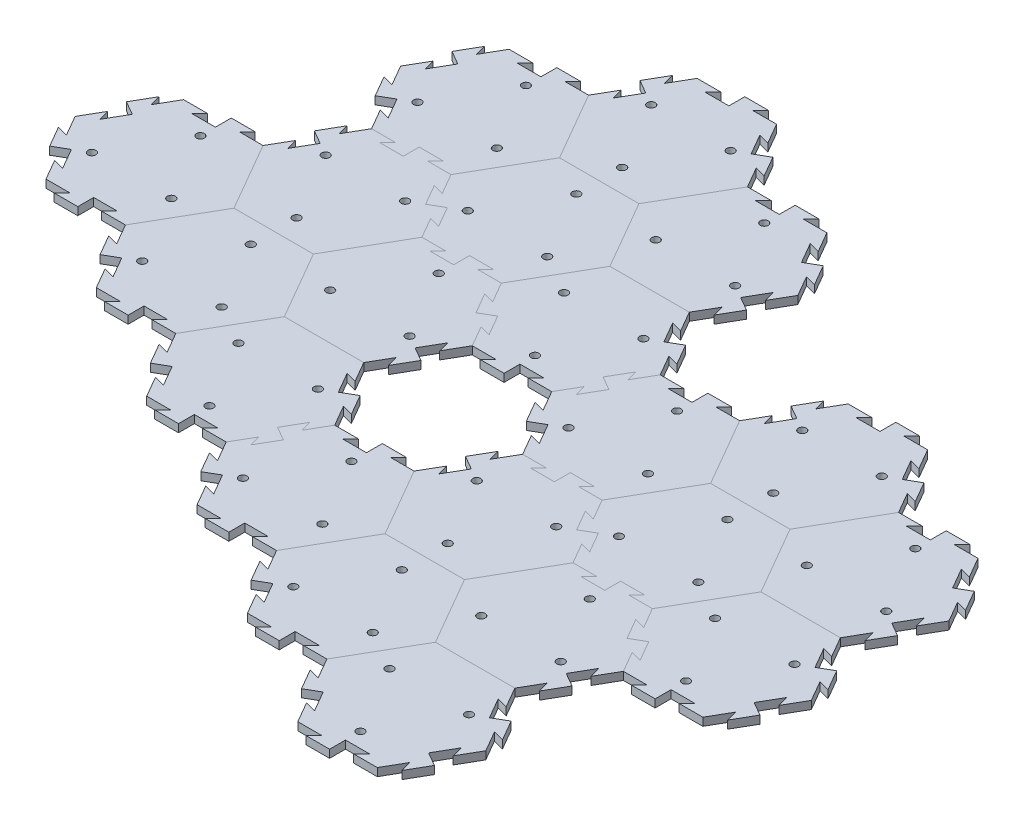
from build123d import *

# Parameters (mm, degrees)
BOSS_EXTRUDE1_DEPTH     = 6.35
SKETCH9_R               = 3.175
CUT_EXTRUDE3_DEPTH      = 85.242269675
CIRPATTERN6_COUNT       = 3
CUT_EXTRUDE2_DEPTH      = 194.232075495
BOSS_EXTRUDE3_DEPTH     = 6.35
CIRPATTERN3_COUNT       = 3
CIRPATTERN3_ANGLE       = 120
CIRPATTERN5_START       = -6.35
CIRPATTERN5_OUTLINE_R   = 3.175
CIRPATTERN5_DEPTH       = 6.35
CIRPATTERN5_2_OUTLINE_R = 3.175
CIRPATTERN5_2_DEPTH     = 6.35
CIRPATTERN5_3_OUTLINE_R = 3.175
CIRPATTERN5_3_DEPTH     = 6.35
BOSS_EXTRUDE4_DEPTH     = 6.35
CUT_EXTRUDE4_DEPTH      = 234.655972662
CIRPATTERN7_COUNT       = 2
CIRPATTERN7_ANGLE       = 60
CUT_EXTRUDE5_DEPTH      = 234.655972662
BOSS_EXTRUDE5_DEPTH     = 6.35
CUT_EXTRUDE6_DEPTH      = 234.655972662
BOSS_EXTRUDE6_DEPTH     = 6.35
LPATTERN3_COUNT         = 2
LPATTERN3_PITCH         = 329.955678924
LPATTERN3_2_COUNT       = 2
LPATTERN3_2_PITCH       = 190.5


# Read off the part's stored shape, not the designer's step: CirPattern5
with BuildPart() as part:
    # Sketch1 → Boss-Extrude1 (new body)
    with BuildSketch(Plane(origin=(0, 0, 0), x_dir=(1, 0, 0), z_dir=(0, 1, 0))):
        Polygon((63.5, 0), (31.75, 54.99261314), (-31.75, 54.99261314), (-63.5, 0), (-31.75, -54.99261314), (31.75, -54.99261314), align=None)
    extrude(amount=-BOSS_EXTRUDE1_DEPTH)

    # Sketch9 → Cut-Extrude3 (cut, through all)
    with BuildSketch(Plane(origin=(0, 0, 0), x_dir=(1, 0, 0), z_dir=(0, 1, 0))):
        with Locations(Location((-31.75, -18.330871047, 0), (0, 0, 270))):
            Circle(SKETCH9_R)
    cut_extrude3 = extrude(amount=-CUT_EXTRUDE3_DEPTH, mode=Mode.SUBTRACT)

    # CirPattern6: Cut-Extrude3 ×3 about axis
    cirpattern6_axis = Axis((0, 0, 0), (0, 1, 0))
    for i in range(1, CIRPATTERN6_COUNT):
        add(cut_extrude3.rotate(cirpattern6_axis, i * 360 / CIRPATTERN6_COUNT), mode=Mode.SUBTRACT)


with BuildPart() as body_2:
    # Mirror1: mirrored copy
    add(part.part.mirror(Plane(origin=(31.75, -6.35, 54.99261314), x_dir=(-0.4999999999999997, 0, 0.8660254037844387), z_dir=(0.8660254037844387, 0, 0.49999999999999983))))

    # Sketch5 → Cut-Extrude2 (cut, through all)
    with BuildSketch(Plane(origin=(0, 0, 0), x_dir=(1, 0, 0), z_dir=(0, 1, 0))):
        Polygon((136.525, -16.497783942), (127.850738686, -14.173522628), (137.375738686, -30.67130657), (142.875, -27.49630657), align=None)
    cut_extrude2 = extrude(amount=-CUT_EXTRUDE2_DEPTH, mode=Mode.SUBTRACT)

    # Sketch7 → Boss-Extrude3 (add)
    with BuildSketch(Plane(origin=(0, 0, 0), x_dir=(1, 0, 0), z_dir=(0, 1, 0))):
        Polygon((142.875, -27.49630657), (148.374261314, -24.32130657), (157.899261314, -40.819090512), (149.225, -38.494829198), align=None)
    boss_extrude3 = extrude(amount=-BOSS_EXTRUDE3_DEPTH)

    # CirPattern3: Cut-Extrude2, Boss-Extrude3 ×3 about axis
    cirpattern3_axis = Axis((95.25, 0, 54.99261314), (0, -1, 0))
    add([cut_extrude2.rotate(cirpattern3_axis, i * CIRPATTERN3_ANGLE / (CIRPATTERN3_COUNT - 1)) for i in range(1, CIRPATTERN3_COUNT)], mode=Mode.SUBTRACT)
    add([boss_extrude3.rotate(cirpattern3_axis, i * CIRPATTERN3_ANGLE / (CIRPATTERN3_COUNT - 1)) for i in range(1, CIRPATTERN3_COUNT)])

    # Sketch14 → Cut-Extrude6 (cut, through all)
    with BuildSketch(Plane(origin=(0, 0, 0), x_dir=(1, 0, 0), z_dir=(0, 1, 0))):
        Polygon((47.625, -82.48891971), (53.124261314, -79.31391971), (62.649261314, -95.811703653), (53.975, -93.487442339), align=None)
    extrude(amount=-CUT_EXTRUDE6_DEPTH, mode=Mode.SUBTRACT)

    # Sketch15 → Boss-Extrude6 (add)
    with BuildSketch(Plane(origin=(0, 0, 0), x_dir=(1, 0, 0), z_dir=(0, 1, 0))):
        Polygon((47.625, -82.48891971), (42.125738686, -85.66391971), (32.600738686, -69.166135768), (41.275, -71.490397082), align=None)
    extrude(amount=-BOSS_EXTRUDE6_DEPTH)


with BuildPart() as body_3:
    # CirPattern5 outline → CirPattern5 (new body)
    with BuildSketch(Plane(origin=(0, 0, 0), x_dir=(1, 0, 0), z_dir=(0, 1, 0)).offset(CIRPATTERN5_START)):
        Polygon((-31.75, 54.99261314), (-63.5, 109.985226281), (-82.55, 109.985226281), (-76.2, 116.335226281), (-95.25, 116.335226281), (-95.25, 103.635226281), (-114.3, 103.635226281), (-107.95, 109.985226281), (-127, 109.985226281), (-136.525, 93.487442339), (-138.849261314, 102.161703653), (-148.374261314, 85.66391971), (-137.375738686, 79.31391971), (-146.900738686, 62.816135768), (-149.225, 71.490397082), (-158.75, 54.99261314), (-149.225, 38.494829198), (-157.899261314, 40.819090512), (-148.374261314, 24.32130657), (-137.375738686, 30.67130657), (-127.850738686, 14.173522628), (-136.525, 16.497783942), (-127, 0), (-63.5, 0), align=None)
        with Locations((-127, 36.661742094)):
            Circle(CIRPATTERN5_OUTLINE_R, mode=Mode.SUBTRACT)
        with Locations((-63.5, 36.661742094)):
            Circle(CIRPATTERN5_OUTLINE_R, mode=Mode.SUBTRACT)
        with Locations((-95.25, 91.654355234)):
            Circle(CIRPATTERN5_OUTLINE_R, mode=Mode.SUBTRACT)
    extrude(amount=CIRPATTERN5_DEPTH)

    # Sketch12 → Cut-Extrude5 (cut, through all)
    with BuildSketch(Plane(origin=(0, 0, 0), x_dir=(1, 0, 0), z_dir=(0, 1, 0))):
        Polygon((-95.25, 0), (-95.25, 6.35), (-76.2, 6.35), (-82.55, 0), align=None)
    extrude(amount=-CUT_EXTRUDE5_DEPTH, mode=Mode.SUBTRACT)

    # Sketch13 → Boss-Extrude5 (add)
    with BuildSketch(Plane(origin=(0, 0, 0), x_dir=(1, 0, 0), z_dir=(0, 1, 0))):
        Polygon((-95.25, 0), (-95.25, -6.35), (-114.3, -6.35), (-107.95, 0), align=None)
    extrude(amount=-BOSS_EXTRUDE5_DEPTH)


with BuildPart() as body_4:
    # CirPattern5 2 outline → CirPattern5 2 (new body)
    with BuildSketch(Plane(origin=(0, 0, 0), x_dir=(1, 0, 0), z_dir=(0, 1, 0)).offset(CIRPATTERN5_START)):
        Polygon((31.75, 54.99261314), (63.5, 109.985226281), (53.975, 126.483010223), (62.649261314, 124.158748909), (53.124261314, 140.656532851), (42.125738686, 134.306532851), (32.600738686, 150.804316793), (41.275, 148.480055479), (31.75, 164.977839421), (12.7, 164.977839421), (19.05, 171.327839421), (0, 171.327839421), (0, 158.627839421), (-19.05, 158.627839421), (-12.7, 164.977839421), (-31.75, 164.977839421), (-41.275, 148.480055479), (-43.599261314, 157.154316793), (-53.124261314, 140.656532851), (-42.125738686, 134.306532851), (-51.650738686, 117.808748909), (-53.975, 126.483010223), (-63.5, 109.985226281), (-31.75, 54.99261314), align=None)
        with Locations((0, 73.323484187)):
            Circle(CIRPATTERN5_2_OUTLINE_R, mode=Mode.SUBTRACT)
        with Locations((-31.75, 128.316097327)):
            Circle(CIRPATTERN5_2_OUTLINE_R, mode=Mode.SUBTRACT)
        with Locations((31.75, 128.316097327)):
            Circle(CIRPATTERN5_2_OUTLINE_R, mode=Mode.SUBTRACT)
    extrude(amount=CIRPATTERN5_2_DEPTH)


with BuildPart() as body_5:
    # CirPattern5 3 outline → CirPattern5 3 (new body)
    with BuildSketch(Plane(origin=(0, 0, 0), x_dir=(1, 0, 0), z_dir=(0, 1, 0)).offset(CIRPATTERN5_START)):
        Polygon((63.5, 0), (127, 0), (136.525, 16.497783942), (138.849261314, 7.823522628), (148.374261314, 24.32130657), (137.375738686, 30.67130657), (146.900738686, 47.169090512), (149.225, 38.494829198), (158.75, 54.99261314), (149.225, 71.490397082), (157.899261314, 69.166135768), (148.374261314, 85.66391971), (137.375738686, 79.31391971), (127.850738686, 95.811703653), (136.525, 93.487442339), (127, 109.985226281), (107.95, 109.985226281), (114.3, 116.335226281), (95.25, 116.335226281), (95.25, 103.635226281), (76.2, 103.635226281), (82.55, 109.985226281), (63.5, 109.985226281), (31.75, 54.99261314), align=None)
        with Locations((63.5, 36.661742094)):
            Circle(CIRPATTERN5_3_OUTLINE_R, mode=Mode.SUBTRACT)
        with Locations((127, 36.661742094)):
            Circle(CIRPATTERN5_3_OUTLINE_R, mode=Mode.SUBTRACT)
        with Locations((95.25, 91.654355234)):
            Circle(CIRPATTERN5_3_OUTLINE_R, mode=Mode.SUBTRACT)
    extrude(amount=CIRPATTERN5_3_DEPTH)


with BuildPart() as part_1:
    add(part.part)

    # Sketch10 → Boss-Extrude4 (add)
    with BuildSketch(Plane(origin=(0, 0, 0), x_dir=(1, 0, 0), z_dir=(0, 1, 0))):
        Polygon((-53.975, -16.497783942), (-62.649261314, -14.173522628), (-53.124261314, -30.67130657), (-47.625, -27.49630657), align=None)
    boss_extrude4 = extrude(amount=-BOSS_EXTRUDE4_DEPTH)

    # Sketch11 → Cut-Extrude4 (cut, through all)
    with BuildSketch(Plane(origin=(0, 0, 0), x_dir=(1, 0, 0), z_dir=(0, 1, 0))):
        Polygon((-47.625, -27.49630657), (-42.125738686, -24.32130657), (-32.600738686, -40.819090512), (-41.275, -38.494829198), align=None)
    cut_extrude4 = extrude(amount=-CUT_EXTRUDE4_DEPTH, mode=Mode.SUBTRACT)

    # CirPattern7: Boss-Extrude4, Cut-Extrude4 ×2 about axis
    cirpattern7_axis = Axis((0, 0, 0), (0, 1, 0))
    add([boss_extrude4.rotate(cirpattern7_axis, i * CIRPATTERN7_ANGLE / (CIRPATTERN7_COUNT - 1)) for i in range(1, CIRPATTERN7_COUNT)])
    add([cut_extrude4.rotate(cirpattern7_axis, i * CIRPATTERN7_ANGLE / (CIRPATTERN7_COUNT - 1)) for i in range(1, CIRPATTERN7_COUNT)], mode=Mode.SUBTRACT)


with BuildPart() as lpattern3_1:
    # LPattern3: pattern copy
    add(body_3.part.moved(Location(Vector(-0.8660254037844385, 0, -0.5000000000000004) * (1 * LPATTERN3_PITCH))))


with BuildPart() as lpattern3_2:
    # LPattern3: pattern copy
    add(body_4.part.moved(Location(Vector(-0.8660254037844385, 0, -0.5000000000000004) * (1 * LPATTERN3_PITCH))))


with BuildPart() as lpattern3_3:
    # LPattern3: pattern copy
    add(body_5.part.moved(Location(Vector(-0.8660254037844385, 0, -0.5000000000000004) * (1 * LPATTERN3_PITCH))))


with BuildPart() as lpattern3_4:
    # LPattern3: pattern copy
    add(part_1.part.moved(Location(Vector(-0.8660254037844385, 0, -0.5000000000000004) * (1 * LPATTERN3_PITCH))))


with BuildPart() as lpattern3_5:
    # LPattern3: pattern copy
    add(body_2.part.moved(Location(Vector(-0.8660254037844385, 0, -0.5000000000000004) * (1 * LPATTERN3_PITCH))))


with BuildPart() as lpattern3_2_1:
    # LPattern3 2: pattern copy
    add(body_3.part.moved(Location(Vector(-0.4999999999999996, 0, 0.8660254037844388) * (1 * LPATTERN3_2_PITCH))))


with BuildPart() as lpattern3_2_2:
    # LPattern3 2: pattern copy
    add(body_4.part.moved(Location(Vector(-0.4999999999999996, 0, 0.8660254037844388) * (1 * LPATTERN3_2_PITCH))))


with BuildPart() as lpattern3_2_3:
    # LPattern3 2: pattern copy
    add(body_5.part.moved(Location(Vector(-0.4999999999999996, 0, 0.8660254037844388) * (1 * LPATTERN3_2_PITCH))))


with BuildPart() as lpattern3_2_4:
    # LPattern3 2: pattern copy
    add(part_1.part.moved(Location(Vector(-0.4999999999999996, 0, 0.8660254037844388) * (1 * LPATTERN3_2_PITCH))))


with BuildPart() as lpattern3_2_5:
    # LPattern3 2: pattern copy
    add(body_2.part.moved(Location(Vector(-0.4999999999999996, 0, 0.8660254037844388) * (1 * LPATTERN3_2_PITCH))))


with BuildPart() as lpattern3_2_6:
    # LPattern3 2: pattern copy
    add(lpattern3_1.part.moved(Location(Vector(-0.4999999999999996, 0, 0.8660254037844388) * (1 * LPATTERN3_2_PITCH))))


with BuildPart() as lpattern3_2_7:
    # LPattern3 2: pattern copy
    add(lpattern3_2.part.moved(Location(Vector(-0.4999999999999996, 0, 0.8660254037844388) * (1 * LPATTERN3_2_PITCH))))


with BuildPart() as lpattern3_2_8:
    # LPattern3 2: pattern copy
    add(lpattern3_3.part.moved(Location(Vector(-0.4999999999999996, 0, 0.8660254037844388) * (1 * LPATTERN3_2_PITCH))))


with BuildPart() as lpattern3_2_9:
    # LPattern3 2: pattern copy
    add(lpattern3_4.part.moved(Location(Vector(-0.4999999999999996, 0, 0.8660254037844388) * (1 * LPATTERN3_2_PITCH))))


with BuildPart() as lpattern3_2_10:
    # LPattern3 2: pattern copy
    add(lpattern3_5.part.moved(Location(Vector(-0.4999999999999996, 0, 0.8660254037844388) * (1 * LPATTERN3_2_PITCH))))


solid = Compound([body_2.part, body_3.part, body_4.part, body_5.part, part_1.part, lpattern3_1.part, lpattern3_2.part, lpattern3_3.part, lpattern3_4.part, lpattern3_5.part, lpattern3_2_1.part, lpattern3_2_2.part, lpattern3_2_3.part, lpattern3_2_4.part, lpattern3_2_5.part, lpattern3_2_6.part, lpattern3_2_7.part, lpattern3_2_8.part, lpattern3_2_9.part, lpattern3_2_10.part])
